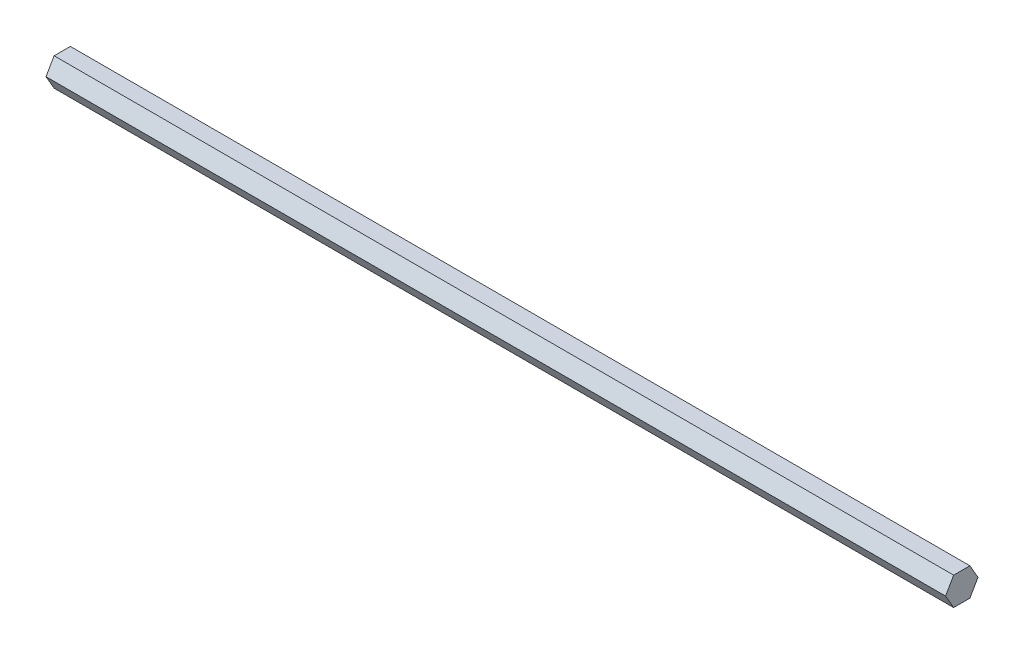
from build123d import *

# Parameters (mm, degrees)
BOSS_EXTRUDE1_DEPTH = 203.2


with BuildPart() as part:
    # Sketch1 → Boss-Extrude1 (new, symmetric)
    with BuildSketch(Plane(origin=(0, 0, 0), x_dir=(0, 0, -1), z_dir=(1, 0, 0))):
        Polygon((7.332348419, 0), (3.666174209, 6.35), (-3.666174209, 6.35), (-7.332348419, 0), (-3.666174209, -6.35), (3.666174209, -6.35), align=None)
    extrude(amount=BOSS_EXTRUDE1_DEPTH, both=True)


solid = part.part
